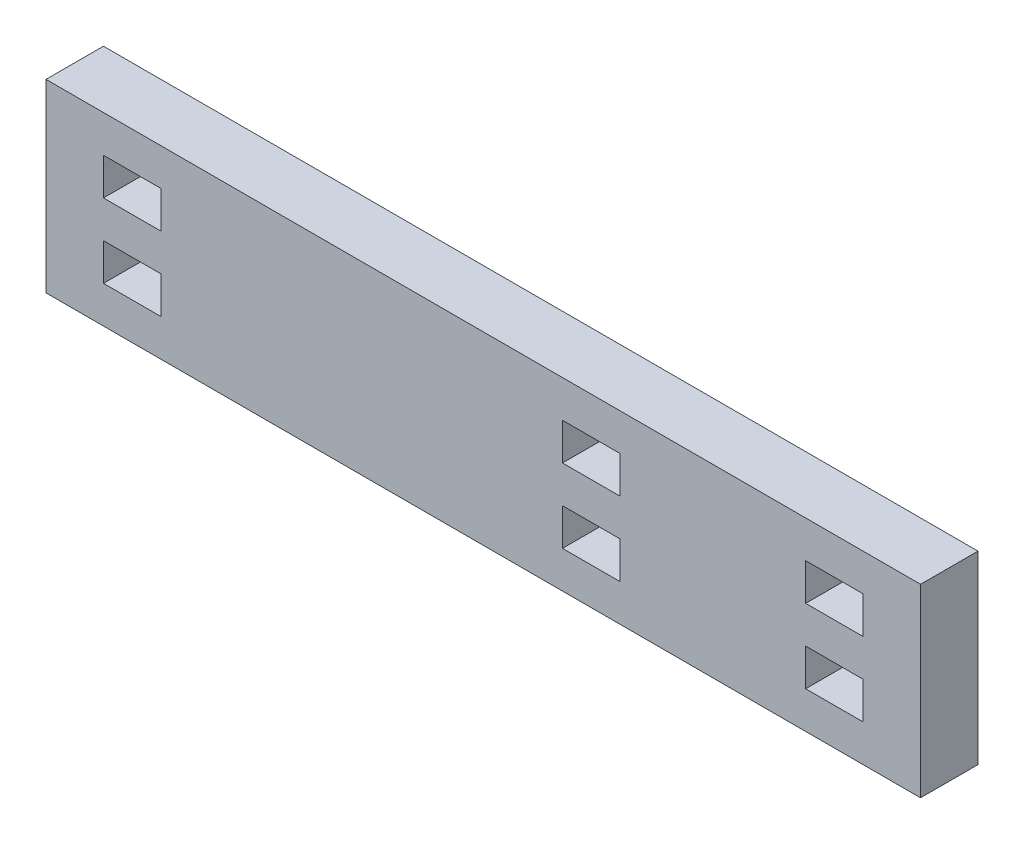
from build123d import *

# Parameters (mm, degrees)
SKETCH1_W           = 78.4
SKETCH1_H           = 16.577
BOSS_EXTRUDE1_DEPTH = 5.15
SKETCH2_W           = 5.15
SKETCH2_H           = 3.3154
CUT_EXTRUDE1_DEPTH  = 5.15


with BuildPart() as part:
    # Sketch1 → Boss-Extrude1 (new body)
    with BuildSketch(Plane.XY):
        with Locations((39.2, 8.2885)):
            Rectangle(SKETCH1_W, SKETCH1_H)
    extrude(amount=BOSS_EXTRUDE1_DEPTH)

    # Sketch2 → Cut-Extrude1 (cut)
    with BuildSketch(Plane.XY.offset(5.15)):
        with Locations((7.725, 11.6039)):
            Rectangle(SKETCH2_W, SKETCH2_H)
        with Locations((7.725, 4.9731)):
            Rectangle(SKETCH2_W, SKETCH2_H)
        with Locations((70.675, 4.9731)):
            Rectangle(SKETCH2_W, SKETCH2_H)
        with Locations((70.675, 11.6039)):
            Rectangle(SKETCH2_W, SKETCH2_H)
        with Locations((48.875, 11.6039)):
            Rectangle(SKETCH2_W, SKETCH2_H)
        with Locations((48.875, 4.9731)):
            Rectangle(SKETCH2_W, SKETCH2_H)
    extrude(amount=-CUT_EXTRUDE1_DEPTH, mode=Mode.SUBTRACT)


solid = part.part
